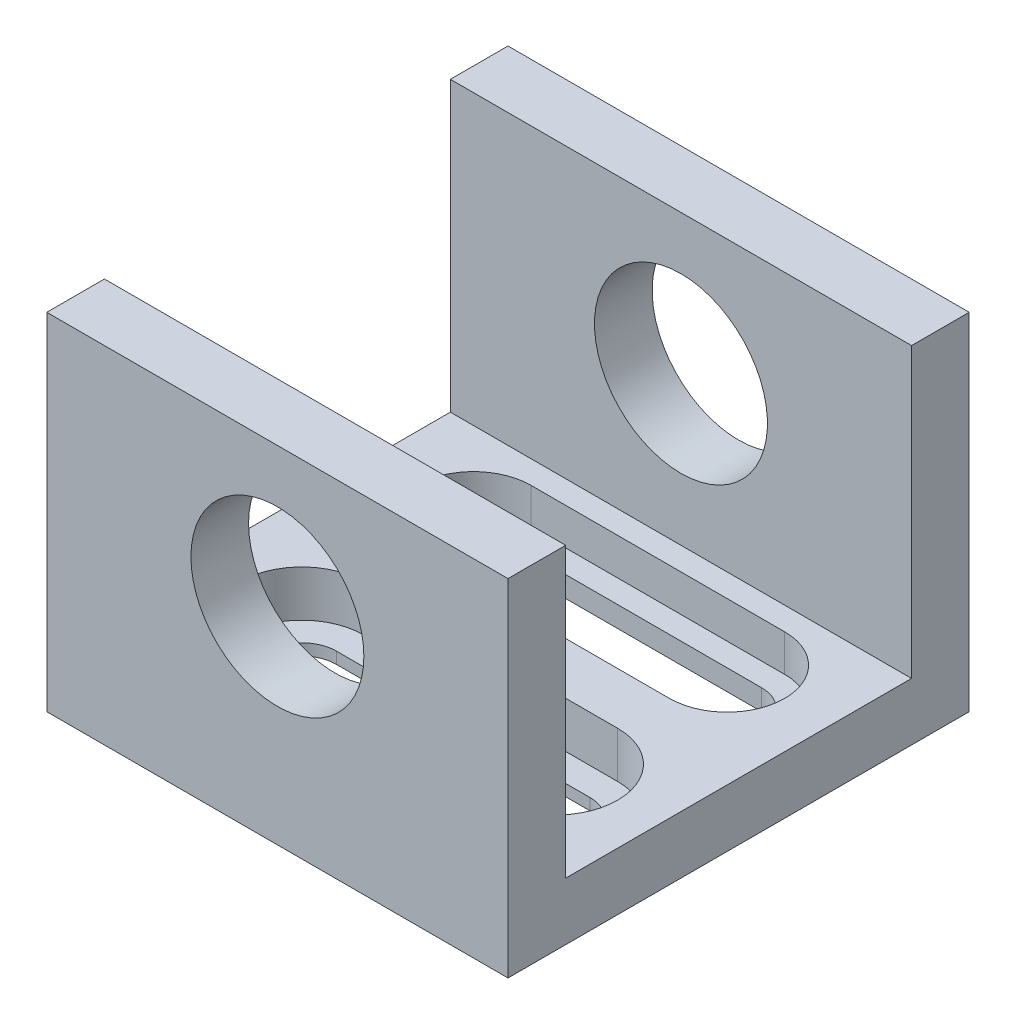
from build123d import *

# Parameters (mm, degrees)
BOSS_EXTRUDE2_DEPTH = 25.4
SKETCH3_R           = 4.7625
CUT_EXTRUDE1_DEPTH  = 36.576
CUT_EXTRUDE2_DEPTH  = 66.04
CUT_EXTRUDE3_DEPTH  = 2.032
CUT_EXTRUDE4_DEPTH  = 2.54
CUT_EXTRUDE5_DEPTH  = 45.510676996


with BuildPart() as part:
    # Sketch1 → Boss-Extrude2 (new body)
    with BuildSketch(Plane(origin=(-35.145897579, 0, 0), x_dir=(0, 0, -1), z_dir=(1, 0, 0))):
        Polygon((0, 0), (-19.05, 0), (-22.225, 0), (-22.225, 19.05), (-19.05, 19.05), (-19.05, 3.175), (0, 3.175), (0, 19.05), (3.175, 19.05), (3.175, 0), align=None)
    extrude(amount=BOSS_EXTRUDE2_DEPTH)

    # Sketch3 → Cut-Extrude1 (cut)
    with BuildSketch(Plane(origin=(0, 0, -3.175), x_dir=(-1, 0, 0), z_dir=(0, 0, -1))):
        with Locations((22.445897579, 11.3665)):
            Circle(SKETCH3_R)
    extrude(amount=-CUT_EXTRUDE1_DEPTH, mode=Mode.SUBTRACT)

    # Sketch4 → Cut-Extrude2 (cut)
    with BuildSketch(Plane(origin=(0, 3.175, 0), x_dir=(1, 0, 0), z_dir=(0, 1, 0))):
        with BuildLine():
            Line((-29.430897579, -2.54), (-15.460897579, -2.54))
            ThreePointArc((-15.460897579, -2.54), (-13.555897579, -4.445), (-15.460897579, -6.35))
            Line((-15.460897579, -6.35), (-29.430897579, -6.35))
            ThreePointArc((-29.430897579, -6.35), (-31.335897579, -4.445), (-29.430897579, -2.54))
        make_face()
    extrude(amount=-CUT_EXTRUDE2_DEPTH, mode=Mode.SUBTRACT)

    # Sketch7 → Cut-Extrude3 (cut)
    with BuildSketch(Plane(origin=(0, 3.175, 0), x_dir=(1, 0, 0), z_dir=(0, 1, 0))):
        with BuildLine():
            Line((-29.430897579, -1.27), (-15.460897579, -1.27))
            ThreePointArc((-15.460897579, -1.27), (-12.285897579, -4.445), (-15.460897579, -7.62))
            Line((-15.460897579, -7.62), (-29.430897579, -7.62))
            ThreePointArc((-29.430897579, -7.62), (-32.605897579, -4.445), (-29.430897579, -1.27))
        make_face()
    extrude(amount=-CUT_EXTRUDE3_DEPTH, mode=Mode.SUBTRACT)

    # Sketch8 → Cut-Extrude4 (cut)
    with BuildSketch(Plane(origin=(0, 3.175, 0), x_dir=(1, 0, 0), z_dir=(0, 1, 0))):
        with BuildLine():
            Line((-15.460897579, -10.469840803), (-29.430897579, -10.469840803))
            ThreePointArc((-29.430897579, -10.469840803), (-32.859897579, -13.898840803), (-29.430897579, -17.327840803))
            Line((-29.430897579, -17.327840803), (-15.460897579, -17.327840803))
            ThreePointArc((-15.460897579, -17.327840803), (-12.031897579, -13.898840803), (-15.460897579, -10.469840803))
        make_face()
    extrude(amount=-CUT_EXTRUDE4_DEPTH, mode=Mode.SUBTRACT)

    # Sketch8<3> → Cut-Extrude5 (cut, through all)
    with BuildSketch(Plane(origin=(0, 3.175, 0), x_dir=(1, 0, 0), z_dir=(0, 1, 0))):
        with BuildLine():
            Line((-15.460897579, -11.993840803), (-29.430897579, -11.993840803))
            ThreePointArc((-29.430897579, -11.993840803), (-31.335897579, -13.898840803), (-29.430897579, -15.803840803))
            Line((-29.430897579, -15.803840803), (-15.460897579, -15.803840803))
            ThreePointArc((-15.460897579, -15.803840803), (-13.555897579, -13.898840803), (-15.460897579, -11.993840803))
        make_face()
    extrude(amount=-CUT_EXTRUDE5_DEPTH, mode=Mode.SUBTRACT)


solid = part.part
